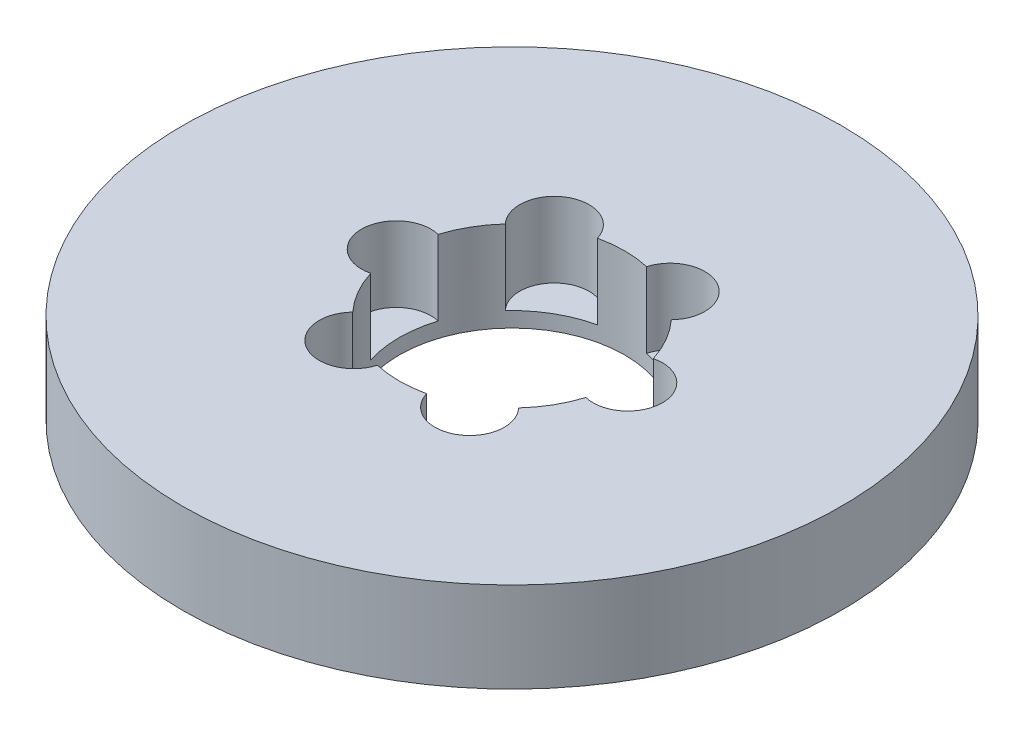
from build123d import *

# Parameters (mm, degrees)
SKETCH1_R           = 95
BOSS_EXTRUDE1_DEPTH = 26
SKETCH2_R           = 32.5
CUT_EXTRUDE1_DEPTH  = 137.842975706
SKETCH3_R           = 10
CUT_EXTRUDE2_DEPTH  = 21.637072692
CIRPATTERN1_COUNT   = 6


with BuildPart() as part:
    # Sketch1 → Boss-Extrude1 (new body)
    with BuildSketch(Plane(origin=(0, 0, 0), x_dir=(1, 0, 0), z_dir=(0, 1, 0))):
        Circle(SKETCH1_R)
    extrude(amount=BOSS_EXTRUDE1_DEPTH)

    # Sketch2 → Cut-Extrude1 (cut, through all)
    with BuildSketch(Plane(origin=(0, 0, 0), x_dir=(1, 0, 0), z_dir=(0, 1, 0))):
        Circle(SKETCH2_R)
    extrude(amount=CUT_EXTRUDE1_DEPTH, mode=Mode.SUBTRACT)

    # Sketch3 → Cut-Extrude2 (cut)
    with BuildSketch(Plane(origin=(0, 26, 0), x_dir=(1, 0, 0), z_dir=(0, 1, 0))):
        with Locations((-33.371618001, 0)):
            Circle(SKETCH3_R)
    cut_extrude2 = extrude(amount=-CUT_EXTRUDE2_DEPTH, mode=Mode.SUBTRACT)

    # CirPattern1: Cut-Extrude2 ×6 about axis
    cirpattern1_axis = Axis((0, 0, 0), (0, 1, 0))
    for i in range(1, CIRPATTERN1_COUNT):
        add(cut_extrude2.rotate(cirpattern1_axis, i * 360 / CIRPATTERN1_COUNT), mode=Mode.SUBTRACT)


solid = part.part
